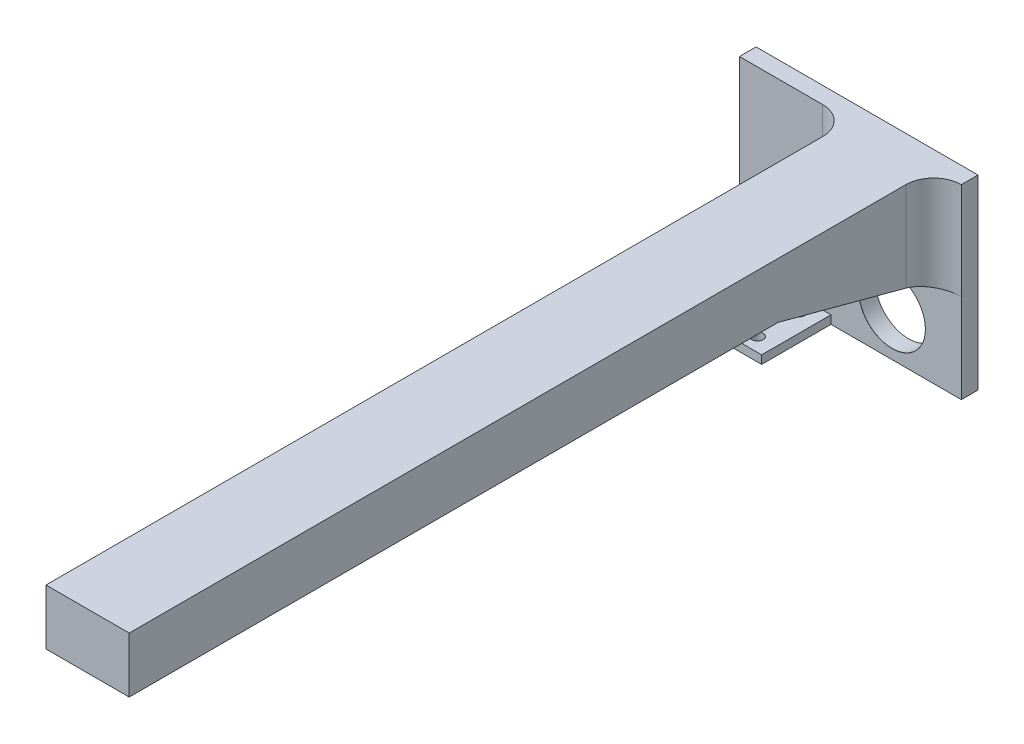
from build123d import *

# Parameters (mm, degrees)
SKETCH1_W                            = 80
SKETCH1_H                            = 73.57
BOSS_EXTRUDE1_DEPTH                  = 3
SKETCH2_W                            = 33
SKETCH2_H                            = 3
BOSS_EXTRUDE2_DEPTH                  = 25
F_4_0_4_DIAMETER_HOLE1_D             = 4
F_4_0_4_DIAMETER_HOLE1_DEPTH         = 8
F_4_0_4_DIAMETER_HOLE1_CSINK_D       = 4.05
F_4_0_4_DIAMETER_HOLE1_CSINK_ANGLE   = 90
F_4_0_4_DIAMETER_HOLE1_TIP           = 1.201721238
F_24_0_24_DIAMETER_HOLE1_D           = 24
F_24_0_24_DIAMETER_HOLE1_DEPTH       = 8
F_24_0_24_DIAMETER_HOLE1_CSINK_D     = 24.05
F_24_0_24_DIAMETER_HOLE1_CSINK_ANGLE = 90
F_24_0_24_DIAMETER_HOLE1_TIP         = 7.210327428
SKETCH11_W                           = 6
SKETCH11_H                           = 6.43
CUT_EXTRUDE2_DEPTH                   = 93.396624533
SKETCH12_W                           = 30
SKETCH12_H                           = 20
BOSS_EXTRUDE5_DEPTH                  = 290
CHAMFER3_SIZE                        = 15
CHAMFER3_SIZE2                       = 55.980762114
FILLET1_R                            = 10


with BuildPart() as part:
    # Sketch1 → Boss-Extrude1 (new, symmetric)
    with BuildSketch(Plane.XY):
        Rectangle(SKETCH1_W, SKETCH1_H)
    extrude(amount=BOSS_EXTRUDE1_DEPTH, both=True)

    # Sketch2 → Boss-Extrude2 (add)
    with BuildSketch(Plane.XY.offset(3)):
        with Locations((-23.5, -28.855)):
            Rectangle(SKETCH2_W, SKETCH2_H)
    extrude(amount=BOSS_EXTRUDE2_DEPTH)

    # Ø4.0 (4) Diameter Hole1
    with Locations(Plane(origin=(0, -27.355, 0), x_dir=(1, 0, 0), z_dir=(0, 1, 0))):
        with Locations((-33.5, -8), (-13.5, -8), (-13.5, -23), (-33.5, -23)):
            CounterSinkHole(F_4_0_4_DIAMETER_HOLE1_D / 2, F_4_0_4_DIAMETER_HOLE1_CSINK_D / 2, depth=F_4_0_4_DIAMETER_HOLE1_DEPTH, counter_sink_angle=F_4_0_4_DIAMETER_HOLE1_CSINK_ANGLE)
            with Locations((0, 0, -(F_4_0_4_DIAMETER_HOLE1_DEPTH + F_4_0_4_DIAMETER_HOLE1_TIP / 2))):  # 118° drill point
                Cone(0, F_4_0_4_DIAMETER_HOLE1_D / 2, F_4_0_4_DIAMETER_HOLE1_TIP, mode=Mode.SUBTRACT)

    # Ø24.0 (24) Diameter Hole1
    with Locations(Plane.XY.offset(3)):
        with Locations((15, -14.855)):
            CounterSinkHole(F_24_0_24_DIAMETER_HOLE1_D / 2, F_24_0_24_DIAMETER_HOLE1_CSINK_D / 2, depth=F_24_0_24_DIAMETER_HOLE1_DEPTH, counter_sink_angle=F_24_0_24_DIAMETER_HOLE1_CSINK_ANGLE)
            with Locations((0, 0, -(F_24_0_24_DIAMETER_HOLE1_DEPTH + F_24_0_24_DIAMETER_HOLE1_TIP / 2))):  # 118° drill point
                Cone(0, F_24_0_24_DIAMETER_HOLE1_D / 2, F_24_0_24_DIAMETER_HOLE1_TIP, mode=Mode.SUBTRACT)

    # Sketch11 → Cut-Extrude2 (cut, through all)
    with BuildSketch(Plane.ZY.offset(40)):
        with Locations((0, -33.57)):
            Rectangle(SKETCH11_W, SKETCH11_H)
    extrude(amount=-CUT_EXTRUDE2_DEPTH, mode=Mode.SUBTRACT)

    # Sketch12 → Boss-Extrude5 (add)
    with BuildSketch(Plane.XY.offset(3)):
        with Locations((15, 26.785)):
            Rectangle(SKETCH12_W, SKETCH12_H)
    extrude(amount=BOSS_EXTRUDE5_DEPTH)

    # Chamfer3
    chamfer3_edges = [part.edges().sort_by_distance(p)[0] for p in [
        (15, 16.785, 3),
    ]]
    chamfer3_side = [part.faces().sort_by_distance(p)[0] for p in [
        (-3.197697434, 2.561053146, 3),
    ]]
    chamfer(chamfer3_edges, length=CHAMFER3_SIZE, length2=CHAMFER3_SIZE2, reference=chamfer3_side[0])

    # Fillet1
    fillet1_edges = [part.edges().sort_by_distance(p)[0] for p in [
        (0, 19.285, 3),
        (30, 19.285, 3),
    ]]
    fillet(fillet1_edges, radius=FILLET1_R - 0.0001)  # a hair under: the kernel refuses the full size


solid = part.part
